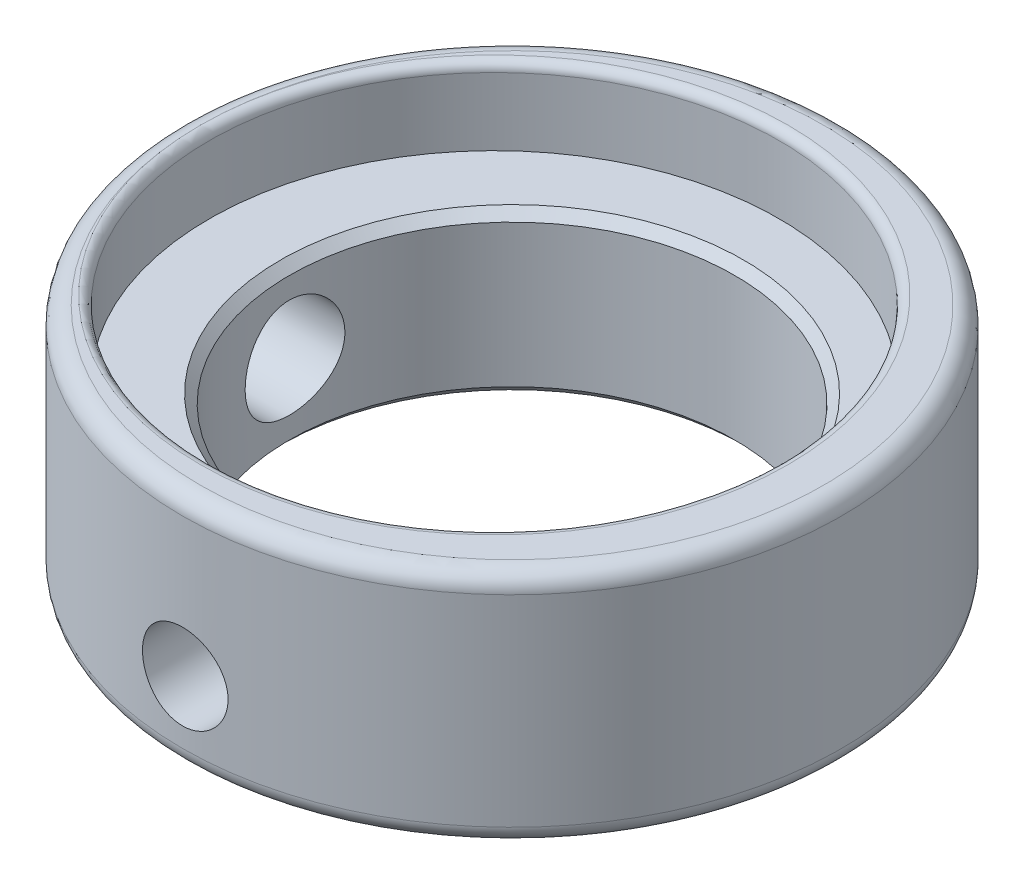
from build123d import *

# Parameters (mm, degrees)
SKETCH_1_R          = 18.5
SKETCH_1_R_2        = 12.5
EXTRUDE_1_DEPTH     = 13.3
SKETCH_2_R          = 16
CUT_EXTRUDE_1_DEPTH = 4.3
SKETCH_3_R          = 2.8
CUT_EXTRUDE_2_DEPTH = 30.349446332
FILLET_1_R          = 1
FILLET_2_R          = 0.5
CHAMFER_1_SIZE      = 0.5
SKETCH_4_R          = 2.4
CUT_EXTRUDE_3_DEPTH = 3.6


with BuildPart() as part:
    # Эскиз1 → Бобышка-Вытянуть1 (new body)
    with BuildSketch(Plane(origin=(0, 0, 0), x_dir=(1, 0, 0), z_dir=(0, 1, 0))):
        with Locations(Location((0, 0, 0), (0, 0, 270))):
            Circle(SKETCH_1_R)
        with Locations(Location((0, 0, 0), (0, 0, 270))):
            Circle(SKETCH_1_R_2, mode=Mode.SUBTRACT)
    extrude(amount=EXTRUDE_1_DEPTH)

    # Эскиз2 → Вырез-Вытянуть1 (cut)
    with BuildSketch(Plane(origin=(0, 13.3, 0), x_dir=(1, 0, 0), z_dir=(0, 1, 0))):
        with Locations(Location((-1, 0, 0), (0, 0, 270))):
            Circle(SKETCH_2_R)
    extrude(amount=-CUT_EXTRUDE_1_DEPTH, mode=Mode.SUBTRACT)

    # Эскиз3 → Вырез-Вытянуть2 (cut, through all)
    with BuildSketch(Plane(origin=(0, 0, 0), x_dir=(0, 0, -1), z_dir=(1, 0, 0))):
        with Locations((0, 4.5)):
            Circle(SKETCH_3_R)
    extrude(amount=-CUT_EXTRUDE_2_DEPTH, mode=Mode.SUBTRACT)

    # Скругление1
    fillet_1_edges = [part.edges().sort_by_distance(p)[0] for p in [
        (0, 0, -18.5),
        (0, 13.3, -18.5),
    ]]
    fillet(fillet_1_edges, radius=FILLET_1_R)

    # Скругление2
    fillet_2_edges = [part.edges().sort_by_distance(p)[0] for p in [
        (-1, 13.3, -16),
    ]]
    fillet(fillet_2_edges, radius=FILLET_2_R - 0.0001)  # a hair under: the kernel refuses the full size

    # Фаска1
    chamfer_1_edges = [part.edges().sort_by_distance(p)[0] for p in [
        (0, 9, -12.5),
        (0, 0, -12.5),
    ]]
    chamfer(chamfer_1_edges, length=CHAMFER_1_SIZE)

    # Эскиз4 → Вырез-Вытянуть3 (cut)
    with BuildSketch(Plane.XY.offset(18.5)):
        with Locations((0, 4.5)):
            Circle(SKETCH_4_R)
    extrude(amount=-CUT_EXTRUDE_3_DEPTH, mode=Mode.SUBTRACT)


solid = part.part
